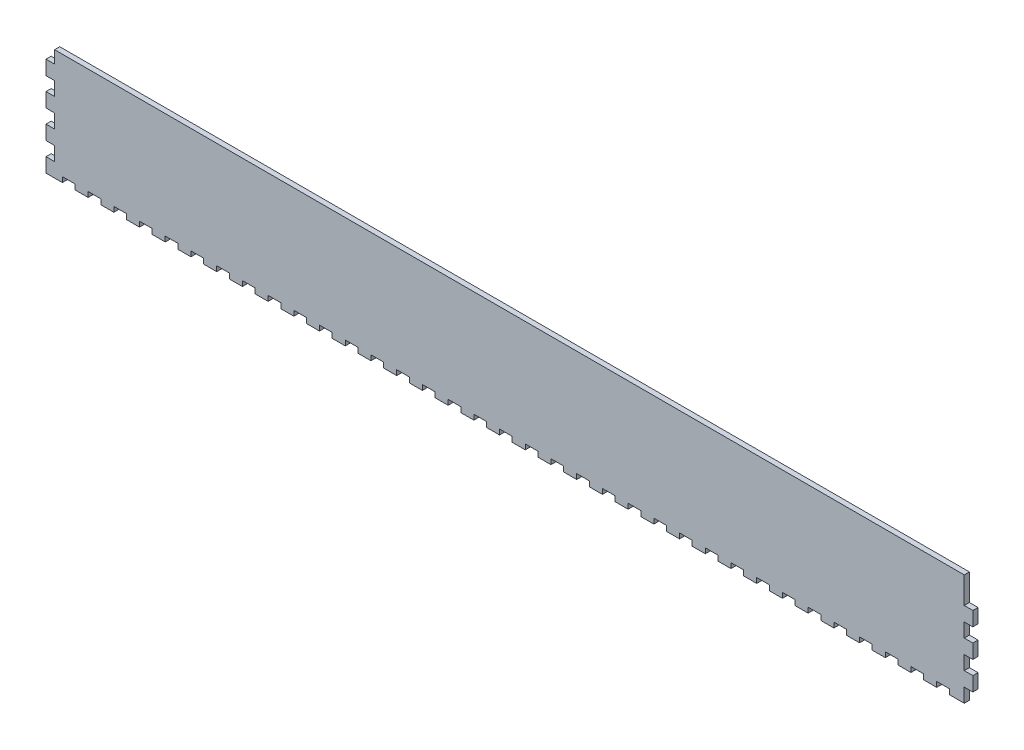
from build123d import *

# Parameters (mm, degrees)
BOSS_EXTRUDE1_DEPTH = 3


with BuildPart() as part:
    # Sketch1 → Boss-Extrude1 (new body)
    with BuildSketch(Plane.XY):
        Polygon((533.360201, 49.205969), (533.360201, 64.599998), (5.000021, 64.599998), (5.000021, 57.33432), (0, 57.33432), (0, 49.03432), (5.000021, 49.03432), (5.000021, 41.06), (0, 41.06), (0, 32.76), (5.000021, 32.76), (5.000021, 24.68), (0, 24.68), (0, 16.38), (5.000021, 16.38), (5.000021, 8.3), (0, 8.3), (0, 0), (9.51847, 0), (9.51847, 3.000022), (16.886903, 3.000022), (16.886903, 0), (24.455363, 0), (24.455363, 3.000022), (31.823833, 3.000022), (31.823833, 0), (39.392256, 0), (39.392256, 3.000022), (46.760726, 3.000022), (46.760726, 0), (54.329184, 0), (54.329184, 3.000022), (61.697619, 3.000022), (61.697619, 0), (69.26608, 0), (69.26608, 3.000022), (76.634513, 3.000022), (76.634513, 0), (84.203148, 0), (84.203148, 3.000022), (91.571265, 3.000022), (91.571265, 0), (99.139759, 0), (99.139759, 3.000022), (106.508229, 3.000022), (106.508229, 0), (114.076723, 0), (114.076723, 3.000022), (121.445193, 3.000022), (121.445193, 0), (129.013687, 0), (129.013687, 3.000022), (136.382162, 3.000022), (136.382162, 0), (143.950657, 0), (143.950657, 3.000022), (151.319112, 3.000022), (151.319112, 0), (158.887606, 0), (158.887606, 3.000022), (166.25609, 3.000022), (166.25609, 0), (173.824217, 0), (173.824217, 3.000022), (181.192701, 3.000022), (181.192701, 0), (188.761195, 0), (188.761195, 3.000022), (196.129651, 3.000022), (196.129651, 0), (203.698145, 0), (203.698145, 3.000022), (211.066629, 3.000022), (211.066629, 0), (218.635123, 0), (218.635123, 3.000022), (226.003579, 3.000022), (226.003579, 0), (233.572073, 0), (233.572073, 3.000022), (240.940557, 3.000022), (240.940557, 0), (248.509051, 0), (248.509051, 3.000022), (255.877506, 3.000022), (255.877506, 0), (263.445662, 0), (263.445662, 3.000022), (270.814117, 3.000022), (270.814117, 0), (278.382612, 0), (278.382612, 3.000022), (285.751095, 3.000022), (285.751095, 0), (293.31959, 0), (293.31959, 3.000022), (300.688045, 3.000022), (300.688045, 0), (308.25654, 0), (308.25654, 3.000022), (315.625023, 3.000022), (315.625023, 0), (323.193518, 0), (323.193518, 3.000022), (330.561973, 3.000022), (330.561973, 0), (338.130129, 0), (338.130129, 3.000022), (345.498584, 3.000022), (345.498584, 0), (353.067079, 0), (353.067079, 3.000022), (360.435562, 3.000022), (360.435562, 0), (368.004057, 0), (368.004057, 3.000022), (375.372512, 3.000022), (375.372512, 0), (382.941006, 0), (382.941006, 3.000022), (390.30949, 3.000022), (390.30949, 0), (397.877984, 0), (397.877984, 3.000022), (405.24644, 3.000022), (405.24644, 0), (412.814934, 0), (412.814934, 3.000022), (420.183418, 3.000022), (420.183418, 0), (427.751545, 0), (427.751545, 3.000022), (435.120029, 3.000022), (435.120029, 0), (442.688523, 0), (442.688523, 3.000022), (450.056979, 3.000022), (450.056979, 0), (457.625473, 0), (457.625473, 3.000022), (464.993957, 3.000022), (464.993957, 0), (472.562451, 0), (472.562451, 3.000022), (479.930906, 3.000022), (479.930906, 0), (487.499401, 0), (487.499401, 3.000022), (494.867884, 3.000022), (494.867884, 0), (502.436379, 0), (502.436379, 3.000022), (509.804495, 3.000022), (509.804495, 0), (517.37299, 0), (517.37299, 3.000022), (524.741445, 3.000022), (524.741445, 0), (533.360201, 0), (533.360201, 8.145808), (538.359853, 8.145808), (538.359853, 16.435068), (533.360201, 16.435068), (533.360201, 24.524345), (538.359853, 24.524345), (538.359853, 32.813605), (533.360201, 32.813605), (533.360201, 40.916707), (538.359853, 40.916707), (538.359853, 49.205969), align=None)
    extrude(amount=BOSS_EXTRUDE1_DEPTH)


solid = part.part
